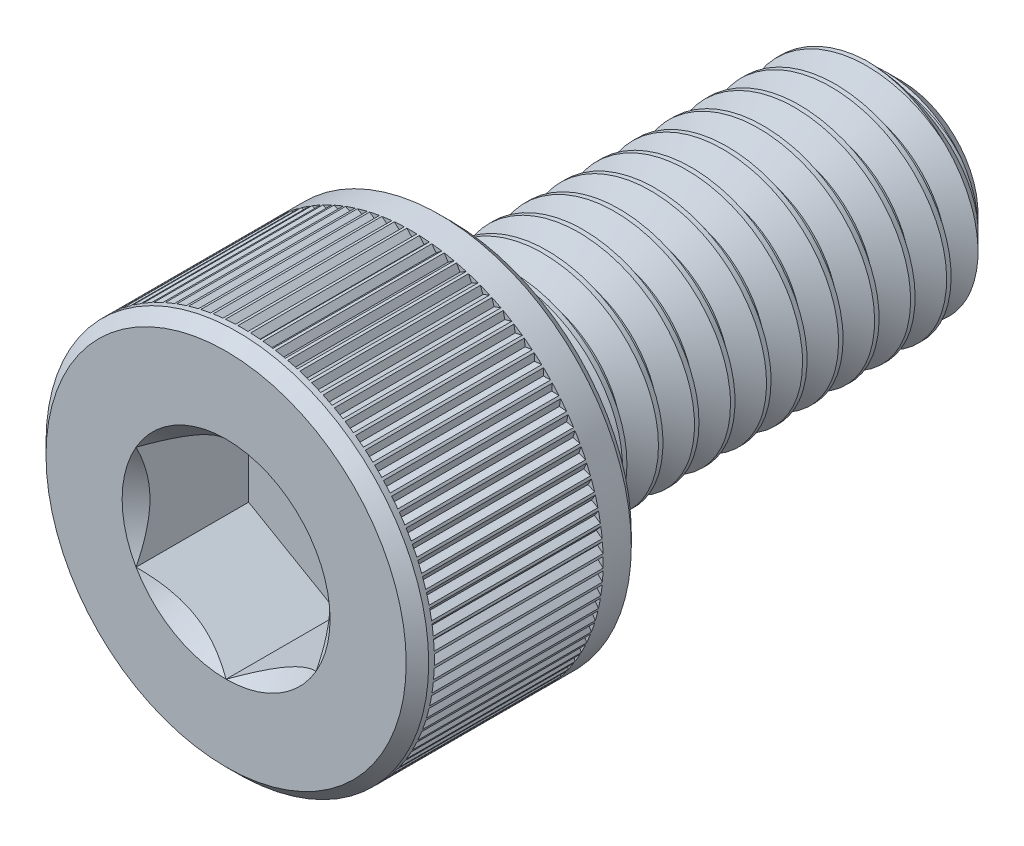
from build123d import *

# Parameters (mm, degrees)
CUT_EXTRUDE1_START = -2.5
CUT_EXTRUDE1_DEPTH = 2.5
SKETCH4_R          = 2.309401077
CUT_EXTRUDE2_DEPTH = 0.5
CUT_EXTRUDE2_DRAFT = -45
CUT_SWEEP1_PITCH   = 0.8
CUT_SWEEP1_TO      = 10
CUT_EXTRUDE4_START = -1.625
CUT_EXTRUDE4_DEPTH = 3.75
CIRPATTERN2_COUNT  = 96


with BuildPart() as part:
    # Sketch2 → Revolve1 (revolve)
    with BuildSketch(Plane(origin=(0, 0, 0), x_dir=(0, 0, -1), z_dir=(1, 0, 0)), mode=Mode.PRIVATE) as revolve1_sk:
        Polygon((-7.25, 4.25), (-2.75, 4.25), (-2.5, 4), (-2.5, 2.5), (6.7, 2.5), (7.5, 1.7), (7.5, 0), (-7.5, 0), (-7.5, 4), align=None)
    revolve(revolve1_sk.sketch.rotate(Axis((0, 0, -7.5), (0, 0, 1)), 90), axis=Axis((0, 0, -7.5), (0, 0, 1)))

    # Sketch3 → Cut-Extrude1 (cut)
    with BuildSketch(Plane.XY.offset(7.5).offset(CUT_EXTRUDE1_START)):
        Polygon((0, 2.309401077), (-2, 1.154700538), (-2, -1.154700538), (0, -2.309401077), (2, -1.154700538), (2, 1.154700538), align=None)
    extrude(amount=CUT_EXTRUDE1_DEPTH, mode=Mode.SUBTRACT)


with BuildPart() as cut_extrude2_tool:
    # Sketch4 → Cut-Extrude2 (with draft: the straight prism first)
    with BuildSketch(Plane.XY.offset(7.5)):
        Circle(SKETCH4_R)
    extrude(amount=-CUT_EXTRUDE2_DEPTH)
    # Cut-Extrude2: the draft: its side faces are tilted about the plane it starts from
    cut_extrude2_sides = [cut_extrude2_tool.faces().sort_by_distance(p)[0] for p in [
        (-2.309401077, 0, 7.25),
    ]]
    draft(cut_extrude2_sides, Plane.XY.offset(7.5), CUT_EXTRUDE2_DRAFT)


with BuildPart() as part_1:
    add(part.part)

    # Cut-Extrude2: cut by cut_extrude2_tool
    add(cut_extrude2_tool.part, mode=Mode.SUBTRACT)


with BuildPart() as body_2:
    # Split1: read off the stored shape, not the designer's step
    # Split1: the piece on the far side of the plane
    add(part_1.part)
    split(bisect_by=Plane.XY.offset(2.5), keep=Keep.BOTTOM)

    # Cut-Sweep1: arcs per turn and ends read off the stored shape
    # Cut-Sweep1: the profile of Sketch7 screwed along a right-hand helix through 13.5 turns, 8 arcs to a turn; built about Z, then put on its axis
    cut_sweep1_z = Axis((0, 0, 0), (0, 0, 1))
    cut_sweep1_corners = [(2.54330127, 0, 0.025), (2.54330127, 0, -0.725), (1.980384758, 0, -0.4), (1.980384758, 0, -0.3)]
    with BuildLine(mode=Mode.PRIVATE) as cut_sweep1_profile:
        Line(cut_sweep1_corners[0], cut_sweep1_corners[1])
        Line(cut_sweep1_corners[1], cut_sweep1_corners[2])
        Line(cut_sweep1_corners[2], cut_sweep1_corners[3])
        Line(cut_sweep1_corners[3], cut_sweep1_corners[0])
    cut_sweep1_cap = Face(cut_sweep1_profile.wire())
    cut_sweep1_turn_angles = [0, 22.5, 45, 67.5, 90, 112.5, 135, 157.5, 180, 202.5, 225, 247.5, 270, 292.5, 315, 337.5, 360]
    cut_sweep1_turn_weights = [1, 0.9238795325112867, 1, 0.9238795325112867, 1, 0.9238795325112867, 1, 0.9238795325112867, 1, 0.9238795325112867, 1, 0.9238795325112867, 1, 0.9238795325112867, 1, 0.9238795325112867, 1]
    cut_sweep1_turn_rails = [Edge.make_bspline([Vector(p[0], p[1], 0).rotate(cut_sweep1_z, cut_sweep1_turn_angles[k]) / cut_sweep1_turn_weights[k] + Vector(0, 0, p[2] + CUT_SWEEP1_PITCH * cut_sweep1_turn_angles[k] / 360) for k in range(17)], [0, 0, 0, 1, 1, 2, 2, 3, 3, 4, 4, 5, 5, 6, 6, 7, 7, 8, 8, 8], 2, cut_sweep1_turn_weights) for p in cut_sweep1_corners]
    cut_sweep1_turn_sides = [Face.make_surface_from_curves(cut_sweep1_turn_rails[p[0]], cut_sweep1_turn_rails[p[1]]) for p in [(0, 1), (1, 2), (2, 3), (3, 0)]]
    cut_sweep1_last_angles = [4680, 4702.5, 4725, 4747.5, 4770, 4792.5, 4815, 4837.5, 4860]
    cut_sweep1_last_weights = [1, 0.9238795325112867, 1, 0.9238795325112867, 1, 0.9238795325112867, 1, 0.9238795325112564, 1]
    cut_sweep1_last_rails = [Edge.make_bspline([Vector(p[0], p[1], 0).rotate(cut_sweep1_z, cut_sweep1_last_angles[k]) / cut_sweep1_last_weights[k] + Vector(0, 0, p[2] + CUT_SWEEP1_PITCH * cut_sweep1_last_angles[k] / 360) for k in range(9)], [0, 0, 0, 1, 1, 2, 2, 3, 3, 4, 4, 4], 2, cut_sweep1_last_weights) for p in cut_sweep1_corners]
    cut_sweep1_last_sides = [Face.make_surface_from_curves(cut_sweep1_last_rails[p[0]], cut_sweep1_last_rails[p[1]]) for p in [(0, 1), (1, 2), (2, 3), (3, 0)]]
    cut_sweep1 = Plane(origin=(0, 0, -7.5), x_dir=(0, 1, 0), z_dir=(0, 0, 1)) * split(Solid(Shell([*[p.moved(Location((0, 0, CUT_SWEEP1_PITCH * i))) for i in range(13) for p in cut_sweep1_turn_sides], *cut_sweep1_last_sides, cut_sweep1_cap, cut_sweep1_cap.rotate(cut_sweep1_z, 4860).moved(Location((0, 0, CUT_SWEEP1_PITCH * 4860 / 360)))])), bisect_by=Plane.XY.offset(CUT_SWEEP1_TO), keep=Keep.BOTTOM, mode=Mode.PRIVATE)
    add(cut_sweep1, mode=Mode.SUBTRACT)


with BuildPart() as part_2:
    add(part_1.part)

    # Split1
    split(bisect_by=Plane.XY.offset(2.5), keep=Keep.TOP)

    add(body_2.part)  # Boss-Extrude1 merges body 2
    # Boss-Extrude1: read off the stored shape, not the designer's step
    # Boss-Extrude1 outline → Boss-Extrude1 (revolve)
    with BuildSketch(Plane.XZ):
        Polygon((1.980380687, 2.5), (1.980380687, 1.980380687), (2.5, 2.5), align=None)
    revolve(axis=Axis((0, 0, 0), (0, 0, 1)))

    # Sketch9 → Cut-Extrude4 (cut)
    with BuildSketch(Plane.XY.offset(5).offset(CUT_EXTRUDE4_START)):
        with BuildLine():
            Line((0, 4.133125), (0.11125203, 4.248543631))
            ThreePointArc((0.11125203, 4.248543631), (0, 4.25), (-0.11125203, 4.248543631))
            Line((-0.11125203, 4.248543631), (0, 4.133125))
        make_face()
    cut_extrude4 = extrude(amount=CUT_EXTRUDE4_DEPTH, mode=Mode.SUBTRACT)

    # CirPattern2: Cut-Extrude4 ×96 about axis
    cirpattern2_axis = Axis((0, 0, 0), (0, 0, 1))
    for i in range(1, CIRPATTERN2_COUNT):
        add(cut_extrude4.rotate(cirpattern2_axis, i * 360 / CIRPATTERN2_COUNT), mode=Mode.SUBTRACT)


solid = part_2.part
